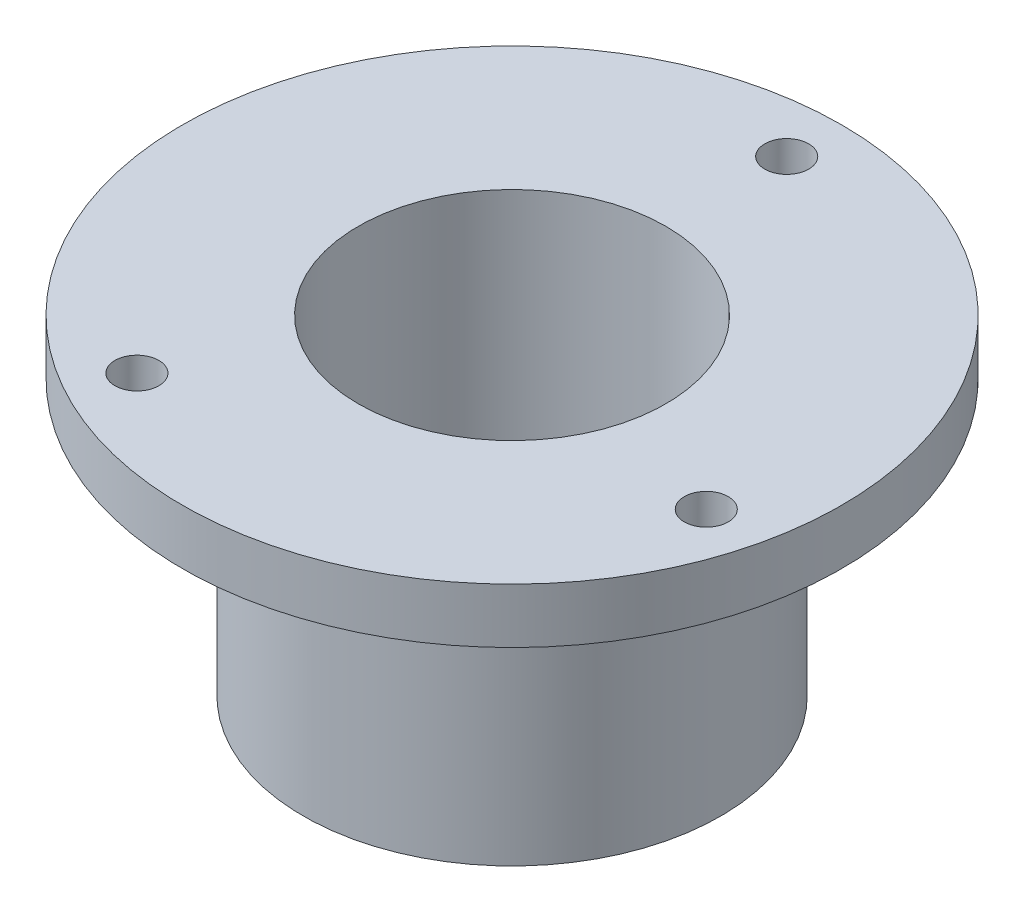
from build123d import *

# Parameters (mm, degrees)
SKETCH2_R          = 1
CUT_EXTRUDE1_DEPTH = 26.980762114


with BuildPart() as part:
    # Sketch1 → Revolve1 (revolve)
    with BuildSketch(Plane.XY):
        Polygon((9.5, 0), (9.5, 12.5), (15, 12.5), (15, 15), (7, 15), (7, 0), align=None)
    revolve(axis=Axis((0, 0, 0), (0, 1, 0)))

    # Sketch2 → Cut-Extrude1 (cut, through all)
    with BuildSketch(Plane(origin=(0, 15, 0), x_dir=(1, 0, 0), z_dir=(0, 1, 0))):
        with Locations((0, 12.5)):
            Circle(SKETCH2_R)
        with Locations((12.074072829, -3.235238064)):
            Circle(SKETCH2_R)
        with Locations((-6.25, -10.825317547)):
            Circle(SKETCH2_R)
    extrude(amount=-CUT_EXTRUDE1_DEPTH, mode=Mode.SUBTRACT)


solid = part.part
